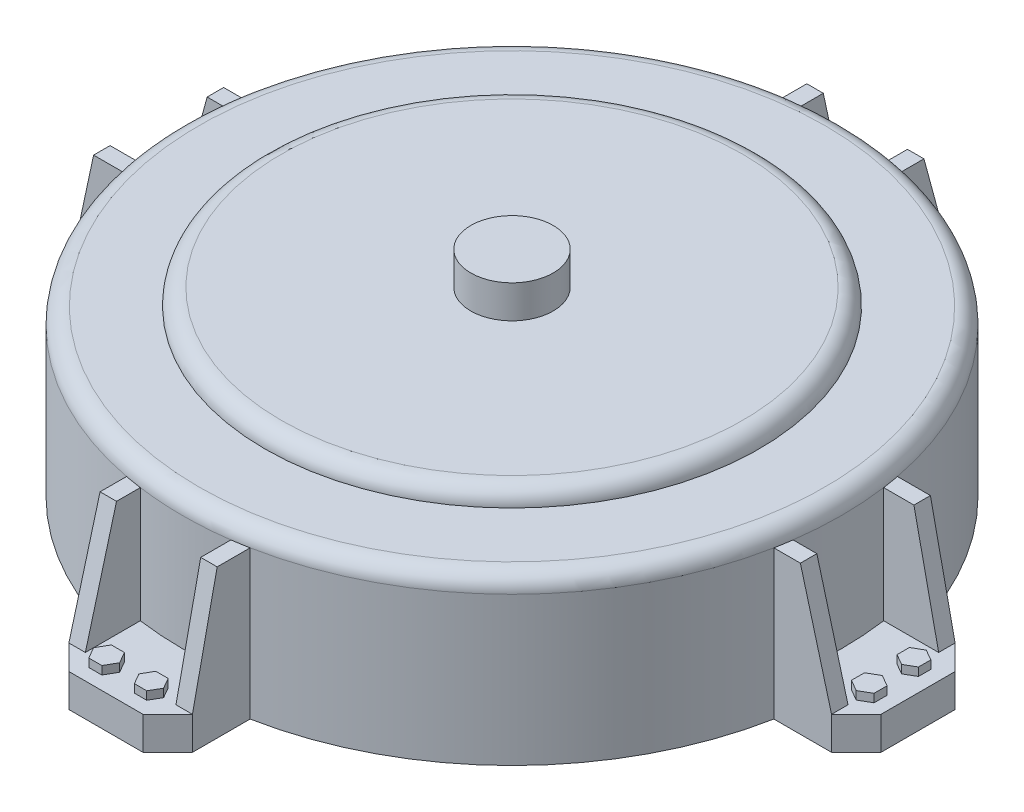
from build123d import *

# Parameters (mm, degrees)
SKETCH2_R                    = 50.8
BOSS_EXTRUDE1_DEPTH          = 25.4
FILLET1_R                    = 2.54
BOSS_EXTRUDE2_START          = -25.4
BOSS_EXTRUDE2_DEPTH          = 5.08
CHAMFER1_SIZE                = 3.81
BOSS_EXTRUDE3_DEPTH          = 2.54
BOSS_EXTRUDE4_DEPTH          = 1.27
BOSS_EXTRUDE6_DEPTH          = 2.54
BOSS_EXTRUDE7_DEPTH          = 1.27
CIRPATTERN1_COUNT            = 4
CHAMFER1_OF_CIRPATTERN1_SIZE = 3.81
CIRPATTERN2_COUNT            = 4
SKETCH12_R                   = 38.1
BOSS_EXTRUDE8_DEPTH          = 2.54
FILLET2_R                    = 2.54
SKETCH13_R                   = 6.35
BOSS_EXTRUDE9_DEPTH          = 5.08


with BuildPart() as part:
    # Sketch2 → Boss-Extrude1 (new body)
    with BuildSketch(Plane(origin=(0, 0, 0), x_dir=(1, 0, 0), z_dir=(0, 1, 0))):
        with Locations(Location((-3.216165312, 3.339863978, 0), (0, 0, 270))):
            Circle(SKETCH2_R)
    extrude(amount=BOSS_EXTRUDE1_DEPTH)

    # Fillet1
    fillet1_edges = [part.edges().sort_by_distance(p)[0] for p in [
        (-3.216165312, 25.4, -54.139863978),
    ]]
    fillet(fillet1_edges, radius=FILLET1_R)

    # Sketch3 → Boss-Extrude2 (add)
    with BuildSketch(Plane(origin=(0, 25.4, 0), x_dir=(1, 0, 0), z_dir=(0, 1, 0)).offset(BOSS_EXTRUDE2_START)):
        with BuildLine():
            Line((-53.115207137, 12.864863978), (-65.815207137, 12.864863978))
            Line((-65.815207137, 12.864863978), (-65.815207137, -6.185136022))
            Line((-65.815207137, -6.185136022), (-53.115207137, -6.185136022))
            ThreePointArc((-53.115207137, -6.185136022), (-54.016165312, 3.339863978), (-53.115207137, 12.864863978))
        make_face()
    boss_extrude2 = extrude(amount=BOSS_EXTRUDE2_DEPTH)

    # Chamfer1
    chamfer1_edges = [part.edges().sort_by_distance(p)[0] for p in [
        (-65.815207137, 2.54, -12.864863978),
        (-65.815207137, 2.54, 6.185136022),
    ]]
    chamfer(chamfer1_edges, length=CHAMFER1_SIZE)

    # Sketch4 → Boss-Extrude3 (add)
    with BuildSketch(Plane.XY.offset(6.185136022)):
        Polygon((-53.115207137, 5.08), (-53.115207137, 22.86), (-58.195207137, 22.86), (-62.005207137, 5.08), align=None)
    boss_extrude3 = extrude(amount=-BOSS_EXTRUDE3_DEPTH)

    # Sketch5 → Boss-Extrude4 (add)
    with BuildSketch(Plane(origin=(0, 5.08, 0), x_dir=(1, 0, 0), z_dir=(0, 1, 0))):
        Polygon((-63.654985531, -0.787636022), (-62.005207137, -1.740136022), (-60.355428742, -0.787636022), (-60.355428742, 1.117363978), (-62.005207137, 2.069863978), (-63.654985531, 1.117363978), align=None)
    boss_extrude4 = extrude(amount=BOSS_EXTRUDE4_DEPTH)

    # Sketch10 → Boss-Extrude6 (add)
    with BuildSketch(Plane(origin=(0, 0, -12.864863978), x_dir=(-1, 0, 0), z_dir=(0, 0, -1))):
        Polygon((53.115207137, 5.08), (53.115207137, 22.86), (57.19920047, 22.86), (62.005207137, 5.08), align=None)
    boss_extrude6 = extrude(amount=-BOSS_EXTRUDE6_DEPTH)

    # Sketch11 → Boss-Extrude7 (add)
    with BuildSketch(Plane(origin=(0, 5.08, 0), x_dir=(1, 0, 0), z_dir=(0, 1, 0))):
        Polygon((-63.745716673, 6.046159142), (-62.005207137, 5.041275493), (-60.264697601, 6.046159142), (-60.264697601, 8.05592644), (-62.005207137, 9.060810089), (-63.745716673, 8.05592644), align=None)
    boss_extrude7 = extrude(amount=BOSS_EXTRUDE7_DEPTH)

    # CirPattern1: Boss-Extrude2, Boss-Extrude3, Boss-Extrude6 ×4 about axis
    cirpattern1_axis = Axis((-3.216165312, 0, -3.339863978), (0, 1, 0))
    add([boss_extrude2.rotate(cirpattern1_axis, i * 360 / CIRPATTERN1_COUNT) for i in range(1, CIRPATTERN1_COUNT)])
    add([boss_extrude3.rotate(cirpattern1_axis, i * 360 / CIRPATTERN1_COUNT) for i in range(1, CIRPATTERN1_COUNT)])
    add([boss_extrude6.rotate(cirpattern1_axis, i * 360 / CIRPATTERN1_COUNT) for i in range(1, CIRPATTERN1_COUNT)])

    # Chamfer1 of CirPattern1
    chamfer1_of_cirpattern1_edges = [part.edges().sort_by_distance(p)[0] for p in [
        (-12.741165312, 2.54, 59.259177846),
        (6.308834688, 2.54, 59.259177846),
        (59.382876512, 2.54, 6.185136022),
        (59.382876512, 2.54, -12.864863978),
        (6.308834688, 2.54, -65.938905803),
        (-12.741165312, 2.54, -65.938905803),
    ]]
    chamfer(chamfer1_of_cirpattern1_edges, length=CHAMFER1_OF_CIRPATTERN1_SIZE)

    # CirPattern2: Boss-Extrude4, Boss-Extrude7 ×4 about axis
    cirpattern2_axis = Axis((-3.216165312, 0, -3.339863978), (0, 1, 0))
    add([boss_extrude4.rotate(cirpattern2_axis, i * 360 / CIRPATTERN2_COUNT) for i in range(1, CIRPATTERN2_COUNT)])
    add([boss_extrude7.rotate(cirpattern2_axis, i * 360 / CIRPATTERN2_COUNT) for i in range(1, CIRPATTERN2_COUNT)])

    # Sketch12 → Boss-Extrude8 (add)
    with BuildSketch(Plane(origin=(0, 25.4, 0), x_dir=(1, 0, 0), z_dir=(0, 1, 0))):
        with Locations(Location((-3.216165312, 3.339863978, 0), (0, 0, 270))):
            Circle(SKETCH12_R)
    extrude(amount=BOSS_EXTRUDE8_DEPTH)

    # Fillet2
    fillet2_edges = [part.edges().sort_by_distance(p)[0] for p in [
        (-3.216165312, 27.94, -41.439863978),
    ]]
    fillet(fillet2_edges, radius=FILLET2_R - 0.0001)  # a hair under: the kernel refuses the full size

    # Sketch13 → Boss-Extrude9 (add)
    with BuildSketch(Plane(origin=(0, 27.94, 0), x_dir=(1, 0, 0), z_dir=(0, 1, 0))):
        with Locations(Location((-3.216165312, 3.339863978, 0), (0, 0, 270))):
            Circle(SKETCH13_R)
    extrude(amount=BOSS_EXTRUDE9_DEPTH)


solid = part.part
